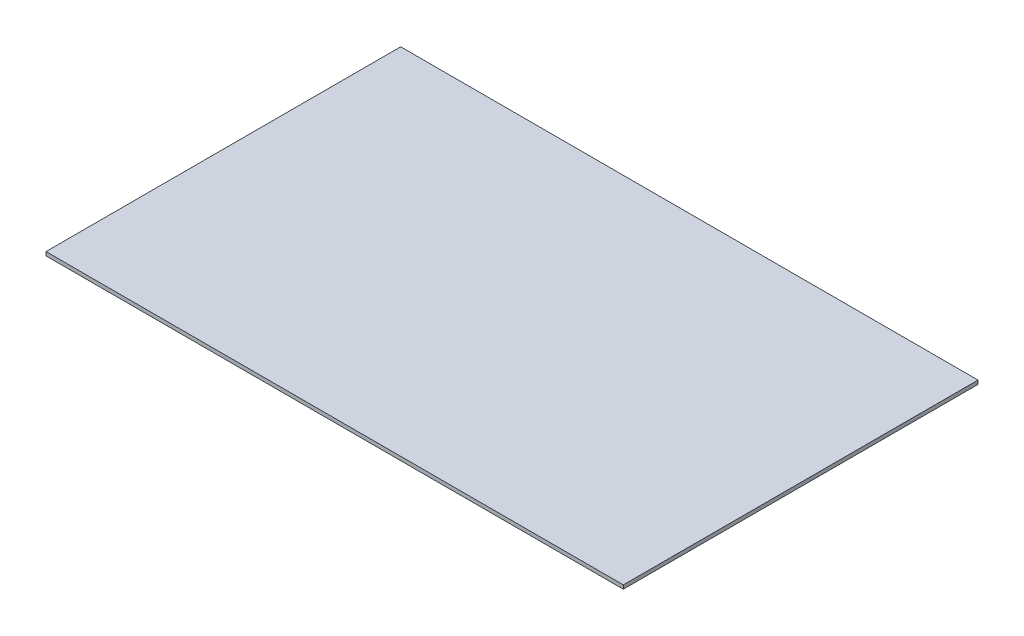
from build123d import *

# Parameters (mm, degrees)
SKETCH_1_W      = 1530
SKETCH_1_H      = 940
EXTRUDE_1_DEPTH = 10


with BuildPart() as part:
    # Эскиз1 → Бобышка-Вытянуть1 (new body)
    with BuildSketch(Plane(origin=(0, 0, 0), x_dir=(1, 0, 0), z_dir=(0, 1, 0))):
        with Locations((765, 470)):
            Rectangle(SKETCH_1_W, SKETCH_1_H)
    extrude(amount=EXTRUDE_1_DEPTH)


solid = part.part
